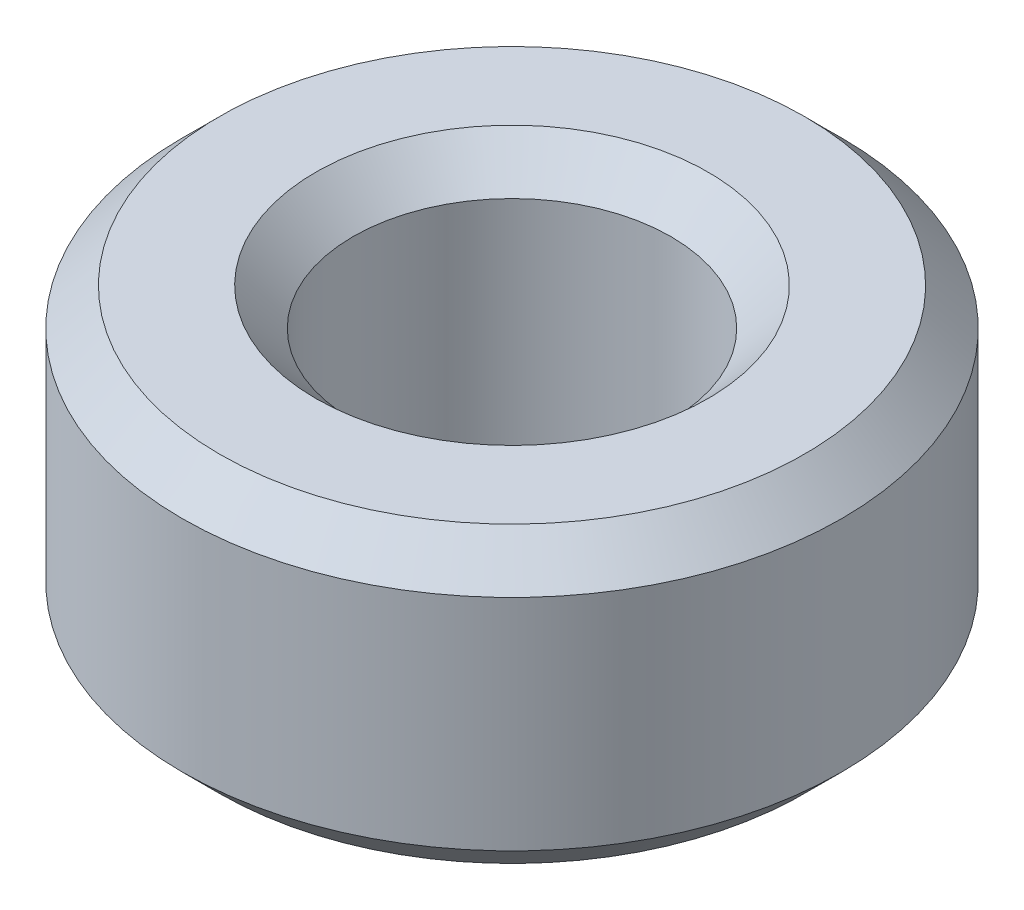
from build123d import *

# Parameters (mm, degrees)
SKETCH1_R           = 12.5
BOSS_EXTRUDE1_DEPTH = 11.142879731
SKETCH2_R           = 6.025092821
CUT_EXTRUDE1_DEPTH  = 21.896501351
CHAMFER1_SIZE       = 1.411086399


with BuildPart() as part:
    # Sketch1 → Boss-Extrude1 (new body)
    with BuildSketch(Plane(origin=(0, 0, 0), x_dir=(1, 0, 0), z_dir=(0, 1, 0))):
        Circle(SKETCH1_R)
    extrude(amount=BOSS_EXTRUDE1_DEPTH)

    # Sketch2 → Cut-Extrude1 (cut, through all)
    with BuildSketch(Plane(origin=(0, 0, 0), x_dir=(1, 0, 0), z_dir=(0, 1, 0))):
        Circle(SKETCH2_R)
    extrude(amount=CUT_EXTRUDE1_DEPTH, mode=Mode.SUBTRACT)

    # Chamfer1
    chamfer1_edges = [part.edges().sort_by_distance(p)[0] for p in [
        (-6.025092821, 11.142879731, 0),
        (-6.025092821, 0, 0),
        (-12.5, 0, 0),
        (-12.5, 11.142879731, 0),
    ]]
    chamfer(chamfer1_edges, length=CHAMFER1_SIZE)


solid = part.part
